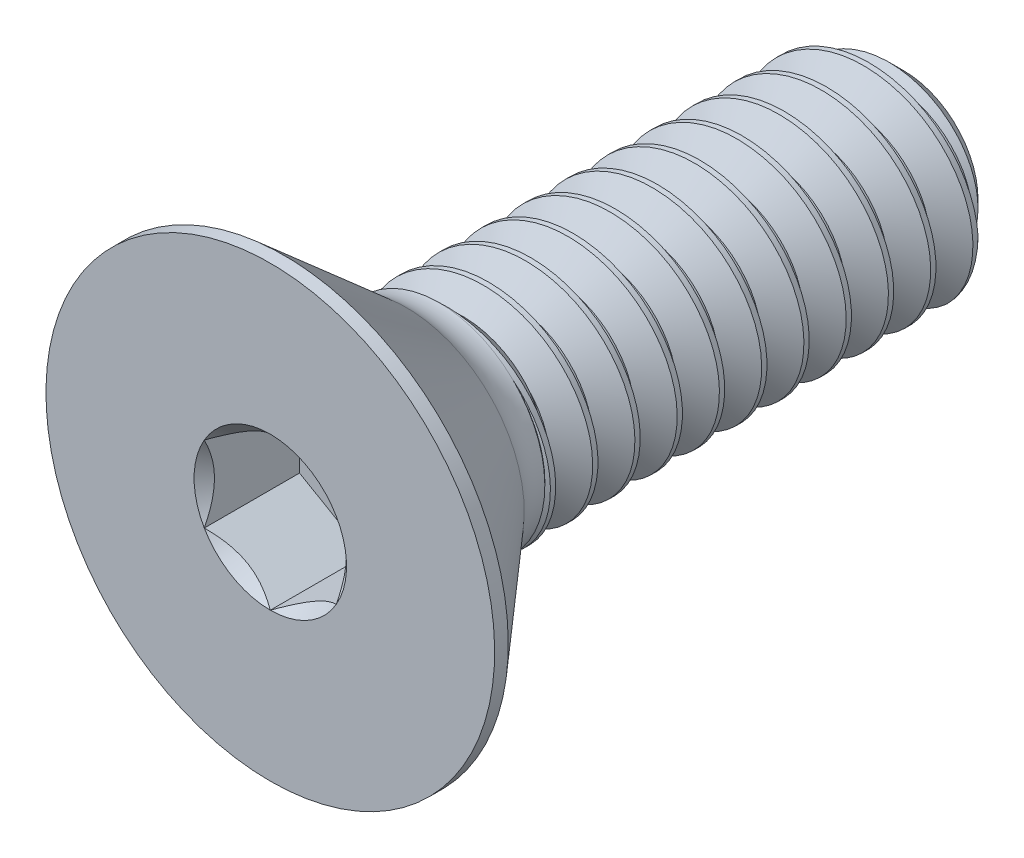
from build123d import *

# Parameters (mm, degrees)
SKETCH1_W          = 19.05
SKETCH1_H          = 3.175
CHAMFER1_SIZE      = 0.9525
CUT_SWEEP1_PITCH   = 1.27
CUT_EXTRUDE2_DEPTH = 2.86258


with BuildPart() as part:
    # Sketch1 → Revolve1 (revolve)
    with BuildSketch(Plane(origin=(0, 0, 0), x_dir=(0, 0, -1), z_dir=(1, 0, 0))):
        with Locations((9.525, 1.5875)):
            Rectangle(SKETCH1_W, SKETCH1_H)
    revolve(axis=Axis((0, 0, -19.05), (0, 0, 1)))

    # Chamfer1
    chamfer1_edges = [part.edges().sort_by_distance(p)[0] for p in [
        (0, -3.175, -19.05),
    ]]
    chamfer(chamfer1_edges, length=CHAMFER1_SIZE)

    # Cut-Sweep1: the profile of Sketch2 profile screwed along a right-hand helix of 15 turns, 8 arcs to a turn; built about Z, then put on its axis
    cut_sweep1_z = Axis((0, 0, 0), (0, 0, 1))
    cut_sweep1_corners = [(3.1756, 0, 0.00034641), (3.1756, 0, -1.11159641), (2.350110803, 0, -0.635), (2.350110803, 0, -0.47625)]
    with BuildLine(mode=Mode.PRIVATE) as cut_sweep1_profile:
        Line(cut_sweep1_corners[0], cut_sweep1_corners[1])
        Line(cut_sweep1_corners[1], cut_sweep1_corners[2])
        Line(cut_sweep1_corners[2], cut_sweep1_corners[3])
        Line(cut_sweep1_corners[3], cut_sweep1_corners[0])
    cut_sweep1_cap = Face(cut_sweep1_profile.wire())
    cut_sweep1_turn_angles = [0, 22.5, 45, 67.5, 90, 112.5, 135, 157.5, 180, 202.5, 225, 247.5, 270, 292.5, 315, 337.5, 360]
    cut_sweep1_turn_weights = [1, 0.9238795325112867, 1, 0.9238795325112867, 1, 0.9238795325112867, 1, 0.9238795325112867, 1, 0.9238795325112867, 1, 0.9238795325112867, 1, 0.9238795325112867, 1, 0.9238795325112867, 1]
    cut_sweep1_turn_rails = [Edge.make_bspline([Vector(p[0], p[1], 0).rotate(cut_sweep1_z, cut_sweep1_turn_angles[k]) / cut_sweep1_turn_weights[k] + Vector(0, 0, p[2] + CUT_SWEEP1_PITCH * cut_sweep1_turn_angles[k] / 360) for k in range(17)], [0, 0, 0, 1, 1, 2, 2, 3, 3, 4, 4, 5, 5, 6, 6, 7, 7, 8, 8, 8], 2, cut_sweep1_turn_weights) for p in cut_sweep1_corners]
    cut_sweep1_turn_sides = [Face.make_surface_from_curves(cut_sweep1_turn_rails[p[0]], cut_sweep1_turn_rails[p[1]]) for p in [(0, 1), (1, 2), (2, 3), (3, 0)]]
    cut_sweep1 = Plane(origin=(0, 0, -19.05), x_dir=(0, 1, 0), z_dir=(0, 0, 1)) * Solid(Shell([*[p.moved(Location((0, 0, CUT_SWEEP1_PITCH * i))) for i in range(15) for p in cut_sweep1_turn_sides], cut_sweep1_cap, cut_sweep1_cap.rotate(cut_sweep1_z, 5400).moved(Location((0, 0, CUT_SWEEP1_PITCH * 5400 / 360)))]))
    add(cut_sweep1, mode=Mode.SUBTRACT)


with BuildPart() as body_2:
    # Sketch7 → Revolve2 (revolve)
    with BuildSketch(Plane(origin=(0, 0, 0), x_dir=(0, 0, -1), z_dir=(1, 0, 0)), mode=Mode.PRIVATE) as revolve2_sk:
        with BuildLine():
            Line((0, 6.7437), (0.40894, 6.7437))
            Line((0.40894, 6.7437), (4.0894, 3.544324933))
            ThreePointArc((4.0894, 3.544324933), (4.549909788, 3.270350399), (5.077204404, 3.175))
            Line((5.077204404, 3.175), (5.077204404, 0))
            Line((5.077204404, 0), (0, 0))
            Line((0, 0), (0, 6.7437))
        make_face()
    revolve(revolve2_sk.sketch.rotate(Axis((0, 0, 0), (0, 0, -1)), 180), axis=Axis((0, 0, 0), (0, 0, -1)))

    # Boss-Extrude1 cone 1 section (through the dimple's axis) → Boss-Extrude1 (revolve)
    with BuildSketch(Plane(origin=(0, 0, -5.077204404), x_dir=(0, -1, 0), z_dir=(1, 0, 0))):
        Polygon((0, 0), (3.175, 0), (0, 3.175), align=None)
    revolve(axis=Axis((0, 0, -5.077204404), (0, 0, -1)))

    # Combine1: union part
    add(part.part)

    # Sketch5 → Cut-Extrude2 (cut)
    with BuildSketch(Plane.XY):
        Polygon((1.984375, -1.14567944), (1.984375, 1.14567944), (0, 2.291358881), (-1.984375, 1.14567944), (-1.984375, -1.14567944), (0, -2.291358881), align=None)
    extrude(amount=-CUT_EXTRUDE2_DEPTH, mode=Mode.SUBTRACT)

    # Cut-Extrude3 cone 1 section (through the dimple's axis) → Cut-Extrude3 (revolve, cut)
    with BuildSketch(Plane(origin=(0, 0, 0), x_dir=(0, -1, 0), z_dir=(1, 0, 0))):
        Polygon((0, 0), (2.291358881, 0), (0, 2.291358881), align=None)
    revolve(axis=Axis((0, 0, 0), (0, 0, -1)), mode=Mode.SUBTRACT)


solid = body_2.part
